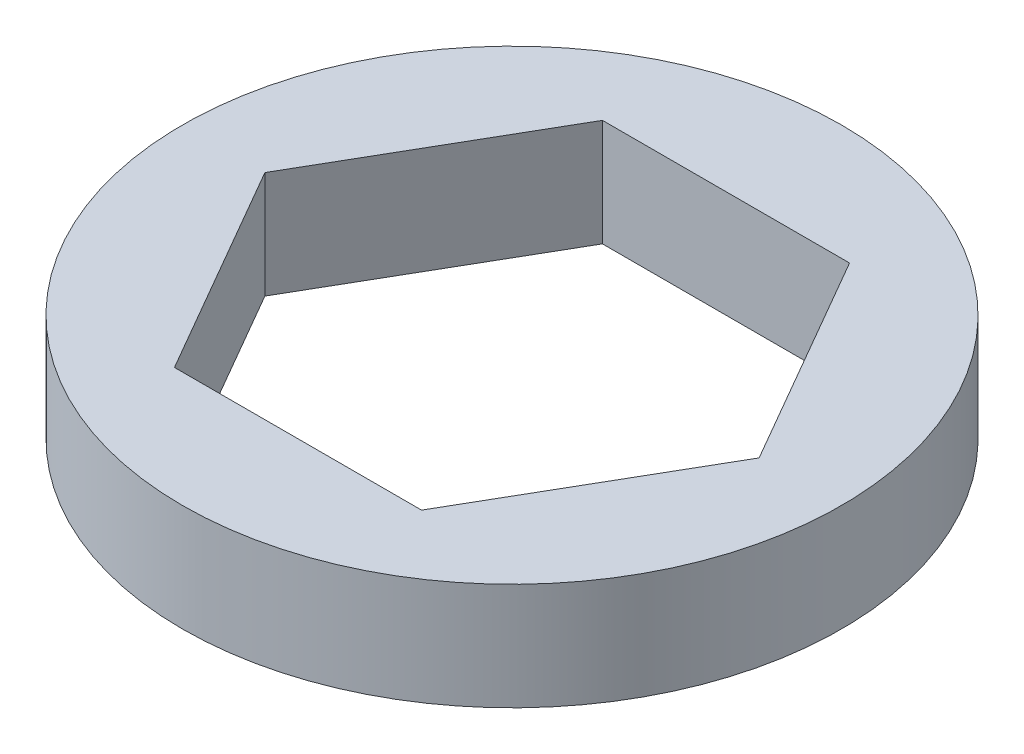
from build123d import *

# Parameters (mm, degrees)
SKETCH1_R           = 9.779
BOSS_EXTRUDE1_DEPTH = 1.5875


with BuildPart() as part:
    # Sketch1 → Boss-Extrude1 (new, symmetric)
    with BuildSketch(Plane(origin=(0, 0, 0), x_dir=(1, 0, 0), z_dir=(0, 1, 0))):
        Circle(SKETCH1_R)
        Polygon((-3.666174209, 6.35), (-7.332348419, 0), (-3.666174209, -6.35), (3.666174209, -6.35), (7.332348419, 0), (3.666174209, 6.35), align=None, mode=Mode.SUBTRACT)
    extrude(amount=BOSS_EXTRUDE1_DEPTH, both=True)


solid = part.part
